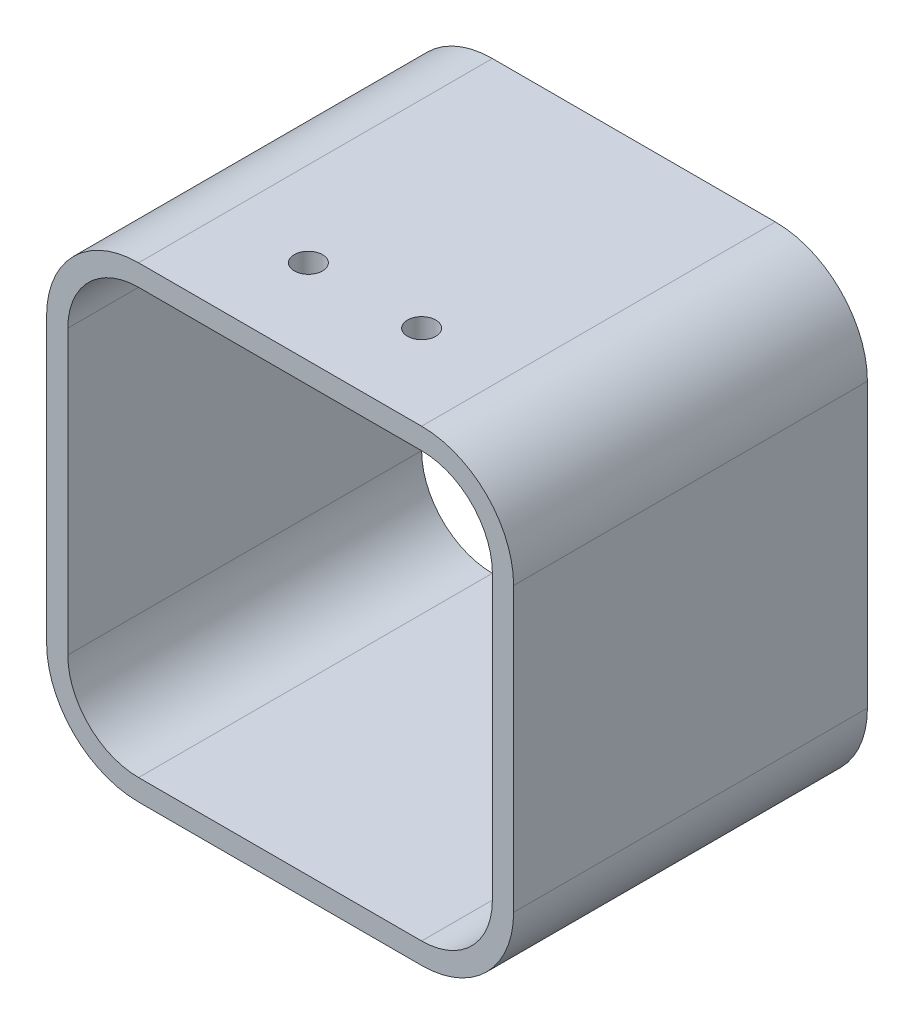
from build123d import *

# Parameters (mm, degrees)
ESTRUSIONE_SOTTILE1_DEPTH = 50
SCHIZZO2_R                = 2
TAGLIO_ESTRUSIONE1_DEPTH  = 10


with BuildPart() as part:
    # Schizzo1 → Estrusione-Sottile1 (new body)
    with BuildSketch(Plane.XY):
        with BuildLine():
            Line((-63, -10), (-63, -50))
            ThreePointArc((-63, -50), (-59.192388155, -59.192388155), (-50, -63))
            Line((-50, -63), (-10, -63))
            ThreePointArc((-10, -63), (-0.807611845, -59.192388155), (3, -50))
            Line((3, -50), (3, -10))
            ThreePointArc((3, -10), (-0.807611845, -0.807611845), (-10, 3))
            Line((-10, 3), (-50, 3))
            ThreePointArc((-50, 3), (-59.192388155, -0.807611845), (-63, -10))
        make_face()
        with BuildLine():
            Line((-60, -10), (-60, -50))
            ThreePointArc((-60, -50), (-57.071067812, -57.071067812), (-50, -60))
            Line((-50, -60), (-10, -60))
            ThreePointArc((-10, -60), (-2.928932188, -57.071067812), (0, -50))
            Line((0, -50), (0, -10))
            ThreePointArc((0, -10), (-2.928932188, -2.928932188), (-10, 0))
            Line((-10, 0), (-50, 0))
            ThreePointArc((-50, 0), (-57.071067812, -2.928932188), (-60, -10))
        make_face(mode=Mode.SUBTRACT)
    extrude(amount=ESTRUSIONE_SOTTILE1_DEPTH)

    # Schizzo2 → Taglio-Estrusione1 (cut)
    with BuildSketch(Plane(origin=(0, 3, 0), x_dir=(1, 0, 0), z_dir=(0, 1, 0))):
        with Locations((-38, -38)):
            Circle(SCHIZZO2_R)
        with Locations((-22, -38)):
            Circle(SCHIZZO2_R)
    extrude(amount=-TAGLIO_ESTRUSIONE1_DEPTH, mode=Mode.SUBTRACT)


solid = part.part
